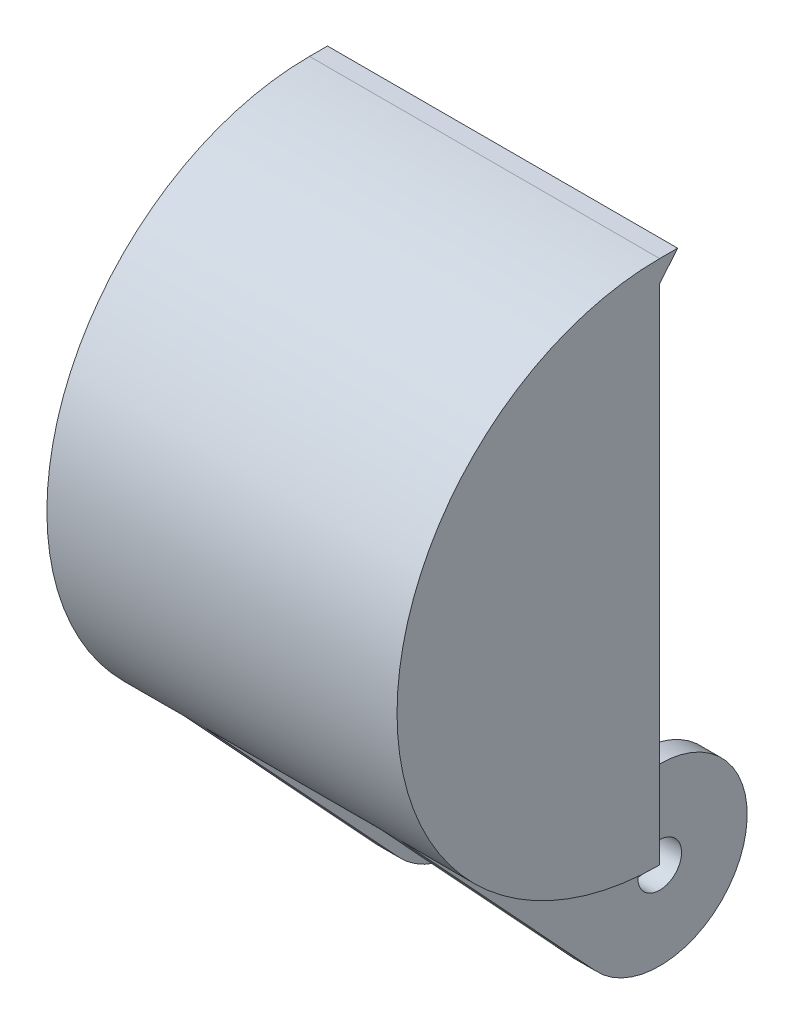
from build123d import *

# Parameters (mm, degrees)
BOSS_EXTRUDE1_DEPTH = 25.4
SHELL1_T            = -3.175
SKETCH4_R           = 12.7
BOSS_EXTRUDE3_DEPTH = 15.875
BOSS_EXTRUDE4_DEPTH = 15.875
SKETCH6_R           = 12.7
CUT_EXTRUDE2_DEPTH  = 12.7
CUT_EXTRUDE3_START  = 12.7
SKETCH6_2_R         = 12.7
CUT_EXTRUDE3_DEPTH  = 12.7
CUT_EXTRUDE4_REACH  = 96.666
SKETCH7_R           = 3.175
BOSS_EXTRUDE5_REACH = 96.666
CUT_EXTRUDE5_DEPTH  = 12.7
BOSS_EXTRUDE6_DEPTH = 25.4
FILLET2_R           = 12.7


with BuildPart() as part:
    # Sketch2 → Boss-Extrude1 (new, symmetric)
    with BuildSketch(Plane(origin=(0, 0, 0), x_dir=(0, 0, -1), z_dir=(1, 0, 0))):
        with BuildLine():
            Line((0, 0), (0, 76.2))
            ThreePointArc((0, 76.2), (-38.1, 38.1), (0, 0))
        make_face()
    extrude(amount=BOSS_EXTRUDE1_DEPTH, both=True)

    # Shell1
    shell1_openings = [part.faces().sort_by_distance(p)[0] for p in [
        (0, 38.1, 0),
    ]]
    offset(amount=SHELL1_T, openings=shell1_openings)



with BuildPart() as body_2:
    # Sketch4 → Boss-Extrude3 (new, symmetric)
    with BuildSketch(Plane(origin=(0, 0, 0), x_dir=(0, 0, -1), z_dir=(1, 0, 0))):
        with Locations((9.525, -9.525)):
            Circle(SKETCH4_R)
    extrude(amount=BOSS_EXTRUDE3_DEPTH, both=True)


with BuildPart() as part_1:
    add(part.part)

    add(body_2.part)  # Boss-Extrude4 merges body 2
    # Sketch5 → Boss-Extrude4 (add, symmetric)
    with BuildSketch(Plane(origin=(0, 0, 0), x_dir=(0, 0, -1), z_dir=(1, 0, 0))):
        with BuildLine():
            Line((0, 3.175), (0, 0))
            Line((0, 0), (1.124739587, 0))
            ThreePointArc((1.124739587, 0), (5.034871939, 2.354762203), (9.525, 3.175))
            Line((9.525, 3.175), (0, 3.175))
        make_face()
    extrude(amount=BOSS_EXTRUDE4_DEPTH, both=True)

    # Sketch6 → Cut-Extrude2 (cut)
    with BuildSketch(Plane(origin=(0, 0, 0), x_dir=(0, 0, -1), z_dir=(1, 0, 0))):
        with Locations((8.980256121, -8.980256121)):
            Circle(SKETCH6_R)
    extrude(amount=-CUT_EXTRUDE2_DEPTH, mode=Mode.SUBTRACT)

    # Sketch6<2> → Cut-Extrude3 (cut)
    with BuildSketch(Plane(origin=(0, 0, 0), x_dir=(0, 0, -1), z_dir=(1, 0, 0)).offset(CUT_EXTRUDE3_START)):
        with Locations((8.980256121, -8.980256121)):
            Circle(SKETCH6_2_R)
    extrude(amount=-CUT_EXTRUDE3_DEPTH, mode=Mode.SUBTRACT)

    # Cut-Extrude4: up to this face of the body (flat: up to its plane)
    cut_extrude4_end = Plane(part_1.part.faces().sort_by_distance((15.875, -9.258016607, -9.360446087))[0])
    # Sketch7 → Cut-Extrude4 (cut, up to the picked face)
    with BuildSketch(Plane.ZY.offset(15.875), mode=Mode.PRIVATE) as cut_extrude4_sk1:
        with Locations(Location((-9.525, -9.525, 0), (0, 0, 180))):
            Circle(SKETCH7_R)
    cut_extrude4_tool1 = split(extrude(cut_extrude4_sk1.sketch, amount=-CUT_EXTRUDE4_REACH, mode=Mode.PRIVATE), bisect_by=cut_extrude4_end, keep=Keep.BOTH, mode=Mode.PRIVATE)
    add(cut_extrude4_tool1.solids().sort_by(Axis((-15.875, -9.525, -9.525), (1, 0, 0)))[0], mode=Mode.SUBTRACT)

    # Boss-Extrude5: up to this face of the body (flat: up to its plane)
    boss_extrude5_end = Plane(part_1.part.faces().sort_by_distance((-15.875, 2.815789755, -4.7625))[0])
    # Sketch8 → Boss-Extrude5 (add, up to the picked face)
    with BuildSketch(Plane(origin=(15.875, 0, 0), x_dir=(0, 0, -1), z_dir=(1, 0, 0)), mode=Mode.PRIVATE) as boss_extrude5_sk1:
        with BuildLine():
            Line((-27.936104056, 12.192779189), (0.212965315, -18.16074027))
            Line((0.212965315, -18.16074027), (5.034871939, -21.404762203))
            Line((5.034871939, -21.404762203), (1.124739587, 0))
            Line((1.124739587, 0), (0, 3.175))
            ThreePointArc((0, 3.175), (-13.704863106, 5.9762961), (-25.211222013, 13.9308066))
            Line((-25.211222013, 13.9308066), (-27.936104056, 12.192779189))
        make_face()
    boss_extrude5_tool1 = split(extrude(boss_extrude5_sk1.sketch, amount=-BOSS_EXTRUDE5_REACH, mode=Mode.PRIVATE), bisect_by=boss_extrude5_end, keep=Keep.BOTH, mode=Mode.PRIVATE)
    add(boss_extrude5_tool1.solids().sort_by(Axis((15.875, -2.840531, 7.724646), (-1, 0, 0)))[0])

    # Sketch9 → Cut-Extrude5 (cut, symmetric)
    with BuildSketch(Plane(origin=(0, 0, 0), x_dir=(0, 0, -1), z_dir=(1, 0, 0))):
        with BuildLine():
            Line((0, 3.175), (0, 0))
            ThreePointArc((0, 0), (-15.240486985, 3.180985746), (-27.936104056, 12.192779189))
            Line((-27.936104056, 12.192779189), (0.212965315, -18.16074027))
            ThreePointArc((0.212965315, -18.16074027), (21.164671418, -14.605162328), (9.525, 3.175))
            Line((9.525, 3.175), (0, 3.175))
        make_face()
    extrude(amount=CUT_EXTRUDE5_DEPTH, both=True, mode=Mode.SUBTRACT)

    # Sketch11 → Boss-Extrude6 (add, symmetric)
    with BuildSketch(Plane(origin=(0, 0, 0), x_dir=(0, 0, -1), z_dir=(1, 0, 0))):
        Polygon((2.609832197, 76.2), (0, 76.2), (0, 73.025), align=None)
    extrude(amount=BOSS_EXTRUDE6_DEPTH, both=True)

    # Fillet2
    # the kernel refuses this fillet: 12.7 mm, written as the material it adds along each edge
    with BuildSketch(Plane(origin=(-22.225, 38.1, 0), x_dir=(0, 1, 0), z_dir=(0, 0, -1))) as fillet2_piece_1:
        with BuildLine():
            CenterArc((34.925 - FILLET2_R, FILLET2_R), FILLET2_R, 270, 90)
            Line((34.925 - FILLET2_R, 0), (34.925, 0))
            Line((34.925, 0), (34.925, FILLET2_R))
        make_face()
    revolve(axis=Axis((-22.225, 38.1, 0), (1, 0, 0)), revolution_arc=180)
    with BuildSketch(Plane(origin=(22.225, 38.1, 0), x_dir=(0, 1, 0), z_dir=(0, 0, -1))) as fillet2_piece_2:
        with BuildLine():
            CenterArc((34.925 - FILLET2_R, -FILLET2_R), FILLET2_R, 0, 90)
            Line((34.925 - FILLET2_R, 0), (34.925, 0))
            Line((34.925, 0), (34.925, -FILLET2_R))
        make_face()
    revolve(axis=Axis((22.225, 38.1, 0), (1, 0, 0)), revolution_arc=180)


solid = part_1.part
